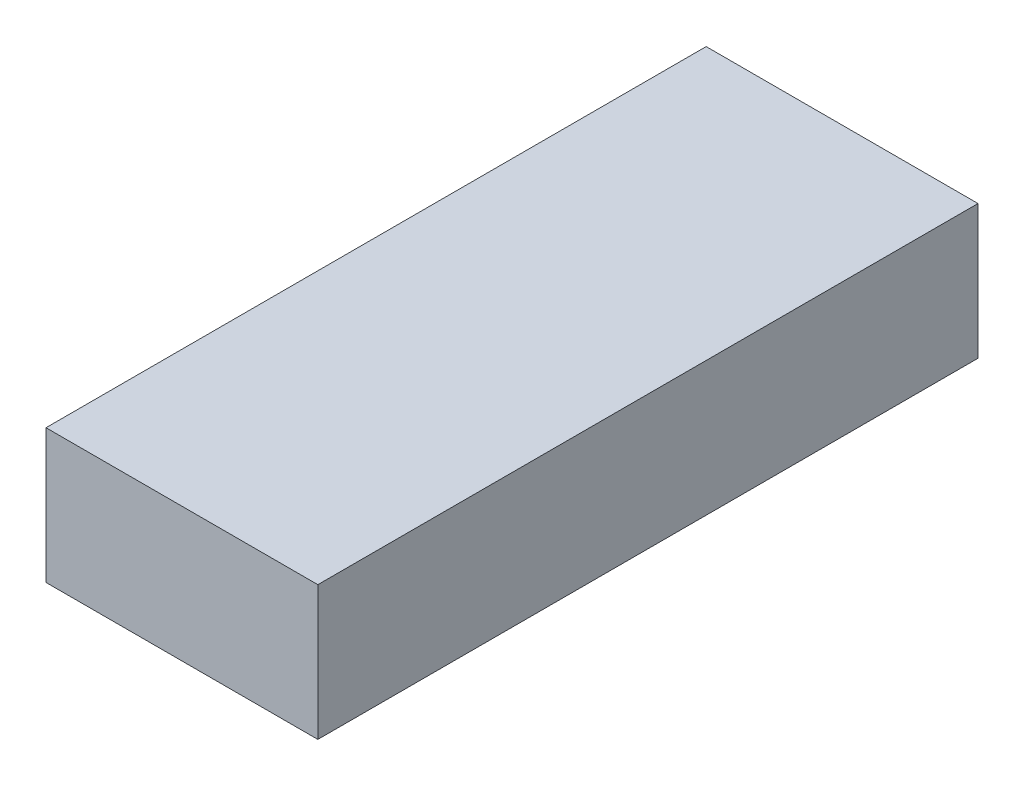
from build123d import *
from OCP.BRepFilletAPI import BRepFilletAPI_MakeChamfer

# Parameters (mm, degrees)
SKETCH1_W           = 35.4
SKETCH1_H           = 99.4
SKETCH1_W_2         = 33
SKETCH1_H_2         = 97
BOSS_EXTRUDE1_DEPTH = 2.4
SKETCH2_W           = 39.4
SKETCH2_H           = 103.4
SKETCH2_W_2         = 35.4
SKETCH2_H_2         = 99.4
BOSS_EXTRUDE3_DEPTH = 15.4
SKETCH3_W           = 39.4
SKETCH3_H           = 103.4
BOSS_EXTRUDE4_DEPTH = 2
BOSS_EXTRUDE5_DEPTH = 21.4
SKETCH5_R           = 5
CUT_EXTRUDE1_DEPTH  = 2.4
SKETCH6_W           = 4
SKETCH6_H           = 105.4
BOSS_EXTRUDE6_DEPTH = 1.6
CHAMFER1_SIZE       = 0.4
CHAMFER1_SIZE_2     = 2


with BuildPart() as part:
    # Sketch1 → Boss-Extrude1 (new body)
    with BuildSketch(Plane(origin=(0, 0, 0), x_dir=(1, 0, 0), z_dir=(0, 1, 0))):
        with Locations((0, 49.5)):
            Rectangle(SKETCH1_W, SKETCH1_H)
        with Locations((0, 49.5)):
            Rectangle(SKETCH1_W_2, SKETCH1_H_2, mode=Mode.SUBTRACT)
    extrude(amount=BOSS_EXTRUDE1_DEPTH)

    # Sketch2 → Boss-Extrude3 (add)
    with BuildSketch(Plane(origin=(0, 2.4, 0), x_dir=(1, 0, 0), z_dir=(0, 1, 0))):
        with Locations((0, 49.5)):
            Rectangle(SKETCH2_W, SKETCH2_H)
        with Locations((0, 49.5)):
            Rectangle(SKETCH2_W_2, SKETCH2_H_2, mode=Mode.SUBTRACT)
    extrude(amount=-BOSS_EXTRUDE3_DEPTH)

    # Sketch3 → Boss-Extrude4 (add)
    with BuildSketch(Plane(origin=(0, 2.4, 0), x_dir=(1, 0, 0), z_dir=(0, 1, 0))):
        with Locations((0, 49.5)):
            Rectangle(SKETCH3_W, SKETCH3_H)
    extrude(amount=BOSS_EXTRUDE4_DEPTH)

    # Sketch4 → Boss-Extrude5 (add)
    with BuildSketch(Plane(origin=(0, 4.4, 0), x_dir=(1, 0, 0), z_dir=(0, 1, 0))):
        Polygon((21.7, 101.2), (21.7, -4.2), (-21.7, -4.2), (-21.7, 101.2), (-19.7, 101.2), (-19.7, -2.2), (19.7, -2.2), (19.7, 101.2), align=None)
    extrude(amount=-BOSS_EXTRUDE5_DEPTH)

    # Sketch5 → Cut-Extrude1 (cut)
    with BuildSketch(Plane.XZ.offset(13)):
        with Locations((-15.2, -23.2)):
            Circle(SKETCH5_R)
        with Locations((15.2, -23.2)):
            Circle(SKETCH5_R)
        with Locations((15.2, -83.2)):
            Circle(SKETCH5_R)
        with Locations((-15.2, -83.2)):
            Circle(SKETCH5_R)
    extrude(amount=CUT_EXTRUDE1_DEPTH, mode=Mode.SUBTRACT)

    # Sketch6 → Boss-Extrude6 (add)
    with BuildSketch(Plane.XZ.offset(17)):
        with Locations((-19.7, -48.5)):
            Rectangle(SKETCH6_W, SKETCH6_H)
        with Locations((19.7, -48.5)):
            Rectangle(SKETCH6_W, SKETCH6_H)
    extrude(amount=-BOSS_EXTRUDE6_DEPTH)

    # Chamfer1
    chamfer1_edges_1 = [part.edges().sort_by_distance(p)[0] for p in [
        (17.7, -15.4, -49.5),
    ]]
    chamfer1_side_1 = [part.faces().sort_by_distance(p)[0] for p in [
        (17.7, -15.408, -49.5),
    ]]
    chamfer1_edges_2 = [part.edges().sort_by_distance(p)[0] for p in [
        (-17.7, -15.4, -49.5),
    ]]
    chamfer1_side_2 = [part.faces().sort_by_distance(p)[0] for p in [
        (-17.708, -15.4, -49.5),
    ]]
    chamfer1 = BRepFilletAPI_MakeChamfer(part.part.solid().wrapped)
    for e in chamfer1_edges_1:
        chamfer1.Add(CHAMFER1_SIZE - 0.0001, CHAMFER1_SIZE_2 - 0.0001, e.wrapped, chamfer1_side_1[0].wrapped)
    for e in chamfer1_edges_2:
        chamfer1.Add(CHAMFER1_SIZE_2 - 0.0001, CHAMFER1_SIZE - 0.0001, e.wrapped, chamfer1_side_2[0].wrapped)
    add(Compound.cast(chamfer1.Shape()), mode=Mode.REPLACE)  # a hair under: the kernel refuses the full size


solid = part.part
